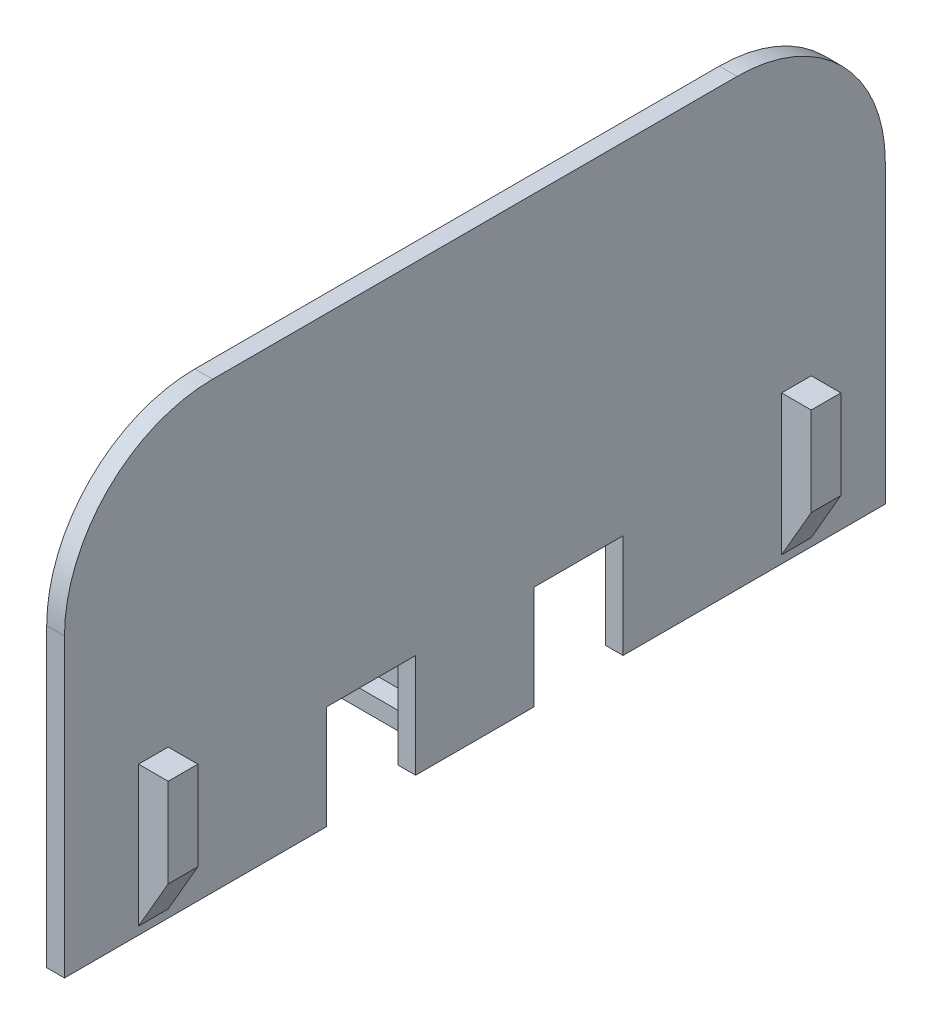
from build123d import *
from OCP.BRepFilletAPI import BRepFilletAPI_MakeChamfer

# Parameters (mm, degrees)
SKETCH_1_W          = 6
SKETCH_1_H          = 277
EXTRUDE_1_DEPTH     = 150
SKETCH_2_W          = 20
SKETCH_2_H          = 40
SKETCH_2_W_2        = 60
SKETCH_2_H_2        = 20
EXTRUDE_2_DEPTH     = 6
EXTRUDE_3_DEPTH     = 7
CHAMFER_2_SIZE      = 54.949548389
CHAMFER_2_SIZE_2    = 20
SKETCH_5_W          = 10
SKETCH_5_H          = 30
EXTRUDE_4_DEPTH     = 10
CHAMFER_3_SIZE      = 17.320508076
CHAMFER_3_SIZE_2    = 10
SKETCH_6_W          = 30
SKETCH_6_H          = 35
CUT_EXTRUDE_1_DEPTH = 10
FILLET_2_R          = 50


with BuildPart() as part:
    # Эскиз1 → Бобышка-Вытянуть1 (new body)
    with BuildSketch(Plane(origin=(0, 0, 0), x_dir=(1, 0, 0), z_dir=(0, 1, 0))):
        Rectangle(SKETCH_1_W, SKETCH_1_H)
    extrude(amount=EXTRUDE_1_DEPTH)

    # Эскиз2 → Бобышка-Вытянуть2 (add)
    with BuildSketch(Plane(origin=(0, 0, 0), x_dir=(1, 0, 0), z_dir=(0, 1, 0))):
        with Locations((-13, 98.5)):
            Rectangle(SKETCH_2_W, SKETCH_2_H)
        with Locations((-13, -98.5)):
            Rectangle(SKETCH_2_W, SKETCH_2_H)
        with Locations((-33, 0)):
            Rectangle(SKETCH_2_W_2, SKETCH_2_H_2)
    extrude(amount=EXTRUDE_2_DEPTH)

    # Эскиз3 → Бобышка-Вытянуть3 (add)
    with BuildSketch(Plane.XY.offset(3.5)):
        Polygon((-3, 6), (-51, 6), (-3, 150), align=None)
    extrude(amount=-EXTRUDE_3_DEPTH)

    # Фаска2
    chamfer_2_edges_1 = [part.edges().sort_by_distance(p)[0] for p in [
        (-3, 6, 98.5),
    ]]
    chamfer_2_side_1 = [part.faces().sort_by_distance(p)[0] for p in [
        (-3, 6.4, 98.5),
    ]]
    chamfer_2_edges_2 = [part.edges().sort_by_distance(p)[0] for p in [
        (-3, 6, -98.5),
    ]]
    chamfer_2_side_2 = [part.faces().sort_by_distance(p)[0] for p in [
        (-3, 6.4, -98.5),
    ]]
    chamfer_2 = BRepFilletAPI_MakeChamfer(part.part.solid().wrapped)
    for e in chamfer_2_edges_1:
        chamfer_2.Add(CHAMFER_2_SIZE - 0.0001, CHAMFER_2_SIZE_2 - 0.0001, e.wrapped, chamfer_2_side_1[0].wrapped)
    for e in chamfer_2_edges_2:
        chamfer_2.Add(CHAMFER_2_SIZE - 0.0001, CHAMFER_2_SIZE_2 - 0.0001, e.wrapped, chamfer_2_side_2[0].wrapped)
    add(Compound.cast(chamfer_2.Shape()), mode=Mode.REPLACE)  # a hair under: the kernel refuses the full size

    # Эскиз5 → Бобышка-Вытянуть4 (add)
    with BuildSketch(Plane(origin=(3, 0, 0), x_dir=(0, 0, -1), z_dir=(1, 0, 0))):
        with Locations((-108.5, 35)):
            Rectangle(SKETCH_5_W, SKETCH_5_H)
        with Locations((108.5, 35)):
            Rectangle(SKETCH_5_W, SKETCH_5_H)
    extrude(amount=EXTRUDE_4_DEPTH)

    # Фаска3
    chamfer_3_edges_1 = [part.edges().sort_by_distance(p)[0] for p in [
        (3, 20, 108.5),
    ]]
    chamfer_3_side_1 = [part.faces().sort_by_distance(p)[0] for p in [
        (3, 19.8, 108.5),
    ]]
    chamfer_3_edges_2 = [part.edges().sort_by_distance(p)[0] for p in [
        (3, 20, -108.5),
    ]]
    chamfer_3_side_2 = [part.faces().sort_by_distance(p)[0] for p in [
        (3, 19.8, -108.5),
    ]]
    chamfer_3 = BRepFilletAPI_MakeChamfer(part.part.solid().wrapped)
    for e in chamfer_3_edges_1:
        chamfer_3.Add(CHAMFER_3_SIZE - 0.0001, CHAMFER_3_SIZE_2 - 0.0001, e.wrapped, chamfer_3_side_1[0].wrapped)
    for e in chamfer_3_edges_2:
        chamfer_3.Add(CHAMFER_3_SIZE - 0.0001, CHAMFER_3_SIZE_2 - 0.0001, e.wrapped, chamfer_3_side_2[0].wrapped)
    add(Compound.cast(chamfer_3.Shape()), mode=Mode.REPLACE)  # a hair under: the kernel refuses the full size

    # Эскиз6 → Вырез-Вытянуть1 (cut)
    with BuildSketch(Plane(origin=(3, 0, 0), x_dir=(0, 0, -1), z_dir=(1, 0, 0))):
        with Locations((-35, 17.5)):
            Rectangle(SKETCH_6_W, SKETCH_6_H)
        with Locations((35, 17.5)):
            Rectangle(SKETCH_6_W, SKETCH_6_H)
    extrude(amount=-CUT_EXTRUDE_1_DEPTH, mode=Mode.SUBTRACT)

    # Скругление2
    fillet_2_edges = [part.edges().sort_by_distance(p)[0] for p in [
        (0, 150, 138.5),
        (0, 150, -138.5),
    ]]
    fillet(fillet_2_edges, radius=FILLET_2_R)


solid = part.part
